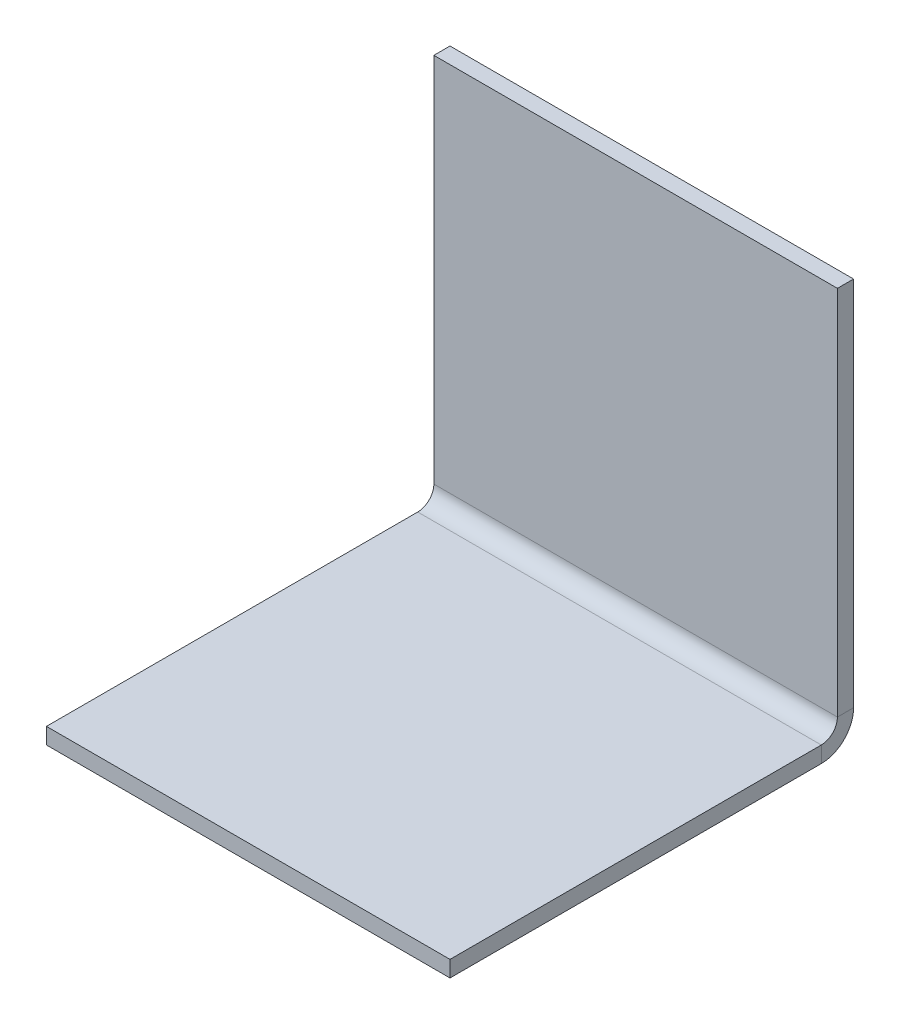
from build123d import *

# Parameters (mm, degrees)
BOSS_EXTRUDE1_DEPTH    = 38.1
CONVERT_SOLID1_DEPTH   = 38.1
CONVERT_SOLID1_2_DEPTH = 38.1


# Read off the part's stored shape, not the designer's step: Convert-Solid1
with BuildPart() as part:
    # Sketch1 → Boss-Extrude1 (new body)
    with BuildSketch(Plane(origin=(0, 0, 0), x_dir=(0, 0, -1), z_dir=(1, 0, 0))):
        Polygon((-1.524, 38.1), (-1.524, 1.524), (-38.1, 1.524), (-38.1, 0), (0, 0), (0, 38.1), align=None)
    extrude(amount=BOSS_EXTRUDE1_DEPTH)

    # Convert-Solid1 outline → Convert-Solid1 (cut)
    with BuildSketch(Plane.YZ):
        with BuildLine():
            ThreePointArc((3.048, 0), (0.892738531, 0.892738531), (0, 3.048))
            Line((0, 3.048), (0, 0))
            Line((0, 0), (3.048, 0))
        make_face()
    extrude(amount=CONVERT_SOLID1_DEPTH, mode=Mode.SUBTRACT)

    # Convert-Solid1 2 outline → Convert-Solid1 2 (add)
    with BuildSketch(Plane.YZ):
        with BuildLine():
            ThreePointArc((3.048, 1.524), (1.970369265, 1.970369265), (1.524, 3.048))
            Line((1.524, 3.048), (1.524, 1.524))
            Line((1.524, 1.524), (3.048, 1.524))
        make_face()
    extrude(amount=CONVERT_SOLID1_2_DEPTH)


solid = part.part
